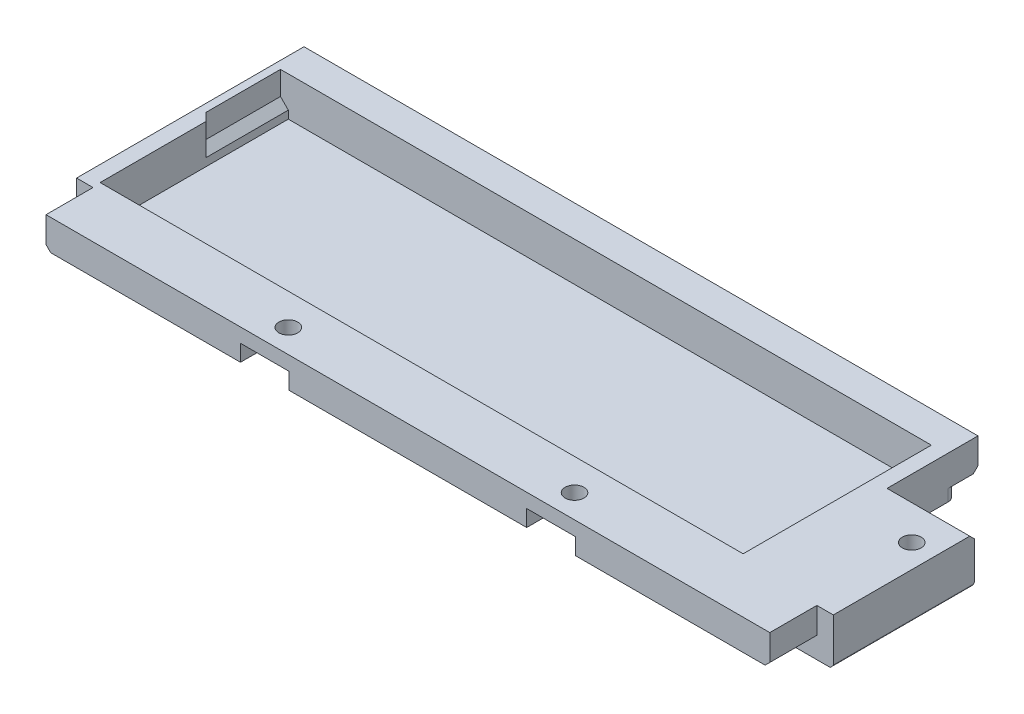
from build123d import *

# Parameters (mm, degrees)
SKETCH_1_W           = 96.5
SKETCH_1_H           = 35
EXTRUDE_1_DEPTH      = 6
SKETCH_2_W           = 82
SKETCH_2_H           = 24
CUT_EXTRUDE_1_DEPTH  = 5
CUT_EXTRUDE_2_DEPTH  = 6
CUT_EXTRUDE_3_DEPTH  = 2.1
FILLET_1_R           = 1
CHAMFER_1_SIZE       = 0.6
CHAMFER_2_SIZE       = 0.4
FILLET_2_R           = 0.2
SKETCH_5_W           = 10.55
SKETCH_5_H           = 11
CUT_EXTRUDE_5_DEPTH  = 103.725167316
CHAMFER_3_SIZE       = 0.6
CHAMFER_4_SIZE       = 0.6
SKETCH_6_W           = 1
SKETCH_6_H           = 9.5
CUT_EXTRUDE_6_DEPTH  = 3
CHAMFER_5_SIZE       = 1
CHAMFER_6_SIZE       = 1
SKETCH_7_W           = 6.2
SKETCH_7_H           = 2.1
CUT_EXTRUDE_7_DEPTH  = 6
SKETCH_8_R           = 1.2
CUT_EXTRUDE_8_DEPTH  = 103.736994311
SKETCH_11_R          = 1.2
CUT_EXTRUDE_9_DEPTH  = 103.826309863
SKETCH_11_3_R        = 2.05
CUT_EXTRUDE_10_DEPTH = 2


with BuildPart() as part:
    # 草图1 → 凸台-拉伸1 (new body)
    with BuildSketch(Plane(origin=(0, 0, 0), x_dir=(1, 0, 0), z_dir=(0, 1, 0))):
        with Locations((48.25, 17.5)):
            Rectangle(SKETCH_1_W, SKETCH_1_H)
    extrude(amount=EXTRUDE_1_DEPTH)

    # 草图2 → 切除-拉伸1 (cut)
    with BuildSketch(Plane(origin=(0, 6, 0), x_dir=(1, 0, 0), z_dir=(0, 1, 0))):
        with Locations((43, 19)):
            Rectangle(SKETCH_2_W, SKETCH_2_H)
    extrude(amount=-CUT_EXTRUDE_1_DEPTH, mode=Mode.SUBTRACT)

    # 草图3 → 切除-拉伸2 (cut)
    with BuildSketch(Plane.XY):
        Polygon((96.5, 6), (96.5, 0), (0, 0), (0, 6), (2.1, 6), (2.1, 2.1), (94.4, 2.1), (94.4, 6), align=None)
    extrude(amount=-CUT_EXTRUDE_2_DEPTH, mode=Mode.SUBTRACT)

    # 草图4 → 切除-拉伸3 (cut)
    with BuildSketch(Plane.XZ):
        Polygon((0, -32.2), (85.95, -32.2), (85.95, -24), (86, -24), (96.5, -24), (96.5, -35), (0, -35), align=None)
    extrude(amount=-CUT_EXTRUDE_3_DEPTH, mode=Mode.SUBTRACT)

    # 圆角1
    fillet_1_edges = [part.edges().sort_by_distance(p)[0] for p in [
        (85.95, 1.05, -32.2),
    ]]
    fillet(fillet_1_edges, radius=FILLET_1_R)

    # 倒角1
    chamfer_1_edges = [part.edges().sort_by_distance(p)[0] for p in [
        (91.225, 0, -24),
        (85.95, 0, -27.6),
        (42.475, 0, -32.2),
        (85.657106781, 0, -31.907106781),
    ]]
    chamfer(chamfer_1_edges, length=CHAMFER_1_SIZE)

    # 倒角2
    chamfer_2_edges = [part.edges().sort_by_distance(p)[0] for p in [
        (96.5, 0, -14.7),
        (0, 0, -18.8),
    ]]
    chamfer(chamfer_2_edges, length=CHAMFER_2_SIZE)

    # 圆角2
    fillet_2_edges = [part.edges().sort_by_distance(p)[0] for p in [
        (96.1, 0, -14.7),
        (0.4, 0, -18.8),
        (96.5, 0.4, -14.9),
        (0, 0.4, -19),
    ]]
    fillet(fillet_2_edges, radius=FILLET_2_R)

    # 草图5 → 切除-拉伸5 (cut, through all)
    with BuildSketch(Plane.XZ.offset(-2.1)):
        with Locations((91.225, -29.5)):
            Rectangle(SKETCH_5_W, SKETCH_5_H)
    extrude(amount=-CUT_EXTRUDE_5_DEPTH, mode=Mode.SUBTRACT)

    # 倒角3
    chamfer_3_edges = [part.edges().sort_by_distance(p)[0] for p in [
        (91.225, 6, -24),
        (2.1, 2.1, -3),
        (94.4, 2.1, -3),
    ]]
    chamfer(chamfer_3_edges, length=CHAMFER_3_SIZE)

    # 倒角4
    chamfer_4_edges = [part.edges().sort_by_distance(p)[0] for p in [
        (42.975, 2.1, -35),
    ]]
    chamfer(chamfer_4_edges, length=CHAMFER_4_SIZE)

    # 草图6 → 切除-拉伸6 (cut)
    with BuildSketch(Plane(origin=(0, 6, 0), x_dir=(1, 0, 0), z_dir=(0, 1, 0))):
        with Locations((1.5, 26.25)):
            Rectangle(SKETCH_6_W, SKETCH_6_H)
    extrude(amount=-CUT_EXTRUDE_6_DEPTH, mode=Mode.SUBTRACT)

    # 倒角5
    chamfer_5_edges = [part.edges().sort_by_distance(p)[0] for p in [
        (2, 3, -26.25),
    ]]
    chamfer(chamfer_5_edges, length=CHAMFER_5_SIZE - 0.0001)  # a hair under: the kernel refuses the full size

    # 倒角6
    chamfer_6_edges = [part.edges().sort_by_distance(p)[0] for p in [
        (2, 4.00005, -21.5),
    ]]
    chamfer(chamfer_6_edges, length=CHAMFER_6_SIZE - 0.0001)  # a hair under: the kernel refuses the full size

    # 草图7 → 切除-拉伸7 (cut)
    with BuildSketch(Plane.XY):
        with Locations((66.5, 3.15)):
            Rectangle(SKETCH_7_W, SKETCH_7_H)
        with Locations((30, 3.15)):
            Rectangle(SKETCH_7_W, SKETCH_7_H)
    extrude(amount=-CUT_EXTRUDE_7_DEPTH, mode=Mode.SUBTRACT)

    # 草图8 → 切除-拉伸8 (cut, through all)
    with BuildSketch(Plane.XZ.offset(-4.2)):
        with Locations(Location((66.5, -3, 0), (0, 0, 270))):
            Circle(SKETCH_8_R)
        with Locations(Location((30, -3, 0), (0, 0, 270))):
            Circle(SKETCH_8_R)
    extrude(amount=-CUT_EXTRUDE_8_DEPTH, mode=Mode.SUBTRACT)

    # 草图11 → 切除-拉伸9 (cut, through all)
    with BuildSketch(Plane.XZ):
        with Locations(Location((93.5, -19, 0), (0, 0, 270))):
            Circle(SKETCH_11_R)
    extrude(amount=-CUT_EXTRUDE_9_DEPTH, mode=Mode.SUBTRACT)

    # 草图11<3> → 切除-拉伸10 (cut)
    with BuildSketch(Plane.XZ):
        with Locations(Location((93.5, -19, 0), (0, 0, 270))):
            Circle(SKETCH_11_3_R)
    extrude(amount=-CUT_EXTRUDE_10_DEPTH, mode=Mode.SUBTRACT)


solid = part.part
